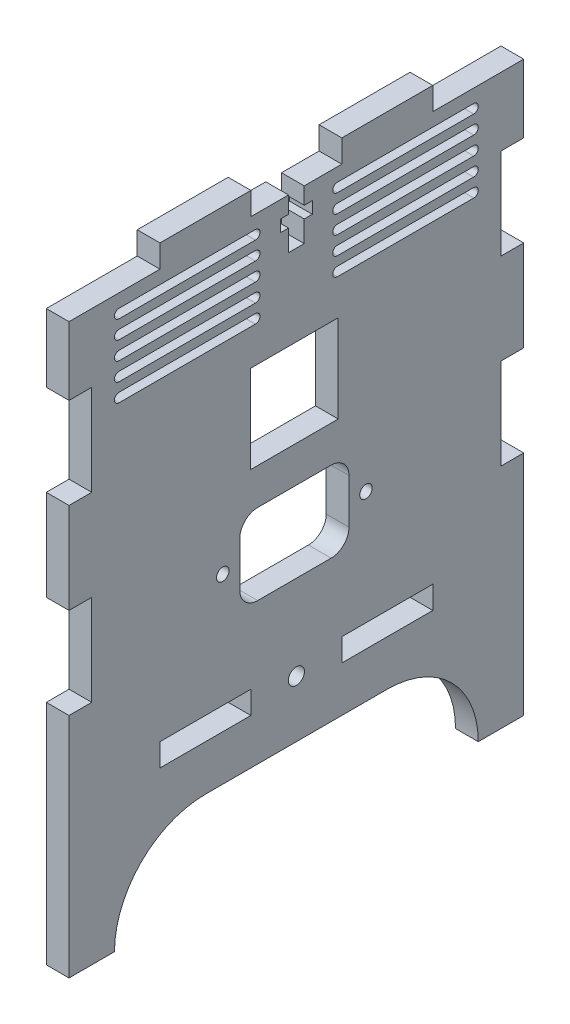
from build123d import *

# Parameters (mm, degrees)
SKETCH1_W                 = 127
SKETCH1_H                 = 165.1
BOSS_EXTRUDE1_DEPTH       = 6.35
SKETCH2_W                 = 25.4
SKETCH2_H                 = 6.35
CUT_EXTRUDE1_DEPTH        = 6.35
LPATTERN1_COUNT           = 3
LPATTERN1_PITCH           = 50.8
CUT_EXTRUDE4_DEPTH        = 6.35
SKETCH8_W                 = 6.35
SKETCH8_H                 = 25.4
CUT_EXTRUDE6_DEPTH        = 6.35
LPATTERN4_COUNT           = 2
LPATTERN4_PITCH           = 50.8
MIRROR1_COPY_1_SKETCH_W   = 6.35
MIRROR1_COPY_1_SKETCH_H   = 25.4
MIRROR1_COPY_1_DEPTH      = 6.35
MIRROR1_COPY_2_SKETCH_W   = 6.35
MIRROR1_COPY_2_SKETCH_H   = 25.4
MIRROR1_COPY_2_DEPTH      = 6.35
SKETCH9_W                 = 25.4
SKETCH9_H                 = 6.35
CUT_EXTRUDE7_DEPTH        = 6.35
LPATTERN6_COUNT           = 2
LPATTERN6_PITCH           = 50.8
SKETCH16_W                = 4.3942
SKETCH16_H                = 13.97
SKETCH16_W_2              = 8.89
SKETCH16_H_2              = 3.302
CUT_EXTRUDE14_DEPTH       = 6.35
F_8_CLEARANCE_HOLE1_D     = 4.4958
F_8_CLEARANCE_HOLE1_DEPTH = 10.16
F_8_CLEARANCE_HOLE1_TIP   = 1.350674586
CUT_EXTRUDE15_DEPTH       = 6.35
LPATTERN7_COPY_1_DEPTH    = 6.35
LPATTERN7_COPY_2_DEPTH    = 6.35
LPATTERN7_COPY_3_DEPTH    = 6.35
LPATTERN7_COPY_4_DEPTH    = 6.35
LPATTERN7_COPY_5_DEPTH    = 6.35
LPATTERN7_COPY_6_DEPTH    = 6.35
LPATTERN7_COPY_7_DEPTH    = 6.35
LPATTERN7_COPY_8_DEPTH    = 6.35
SKETCH20_R                = 1.75
CUT_EXTRUDE16_DEPTH       = 7.62
SKETCH22_W                = 24.5
SKETCH22_H                = 24.5
CUT_EXTRUDE17_DEPTH       = 6.35


with BuildPart() as part:
    # Sketch1 → Boss-Extrude1 (new body)
    with BuildSketch(Plane(origin=(0, 0, 0), x_dir=(0, 0, -1), z_dir=(1, 0, 0))):
        Rectangle(SKETCH1_W, SKETCH1_H)
    extrude(amount=BOSS_EXTRUDE1_DEPTH)

    # Sketch2 → Cut-Extrude1 (cut)
    with BuildSketch(Plane(origin=(6.35, 0, 0), x_dir=(0, 0, -1), z_dir=(1, 0, 0))):
        with Locations((-50.8, 79.375)):
            Rectangle(SKETCH2_W, SKETCH2_H)
    cut_extrude1 = extrude(amount=-CUT_EXTRUDE1_DEPTH, mode=Mode.SUBTRACT)

    # LPattern1: Cut-Extrude1 ×3
    with Locations(*[(0, 0, -i * LPATTERN1_PITCH) for i in range(1, LPATTERN1_COUNT)]):
        add(cut_extrude1, mode=Mode.SUBTRACT)

    # Sketch5 → Cut-Extrude4 (cut)
    with BuildSketch(Plane(origin=(6.35, 0, 0), x_dir=(0, 0, -1), z_dir=(1, 0, 0))):
        with BuildLine():
            Line((-25.4, -57.15), (25.4, -57.15))
            ThreePointArc((25.4, -57.15), (50.8, -82.55), (25.4, -107.95))
            Line((25.4, -107.95), (-25.4, -107.95))
            ThreePointArc((-25.4, -107.95), (-50.8, -82.55), (-25.4, -57.15))
        make_face()
    extrude(amount=-CUT_EXTRUDE4_DEPTH, mode=Mode.SUBTRACT)

    # Sketch8 → Cut-Extrude6 (cut)
    with BuildSketch(Plane(origin=(6.35, 0, 0), x_dir=(0, 0, -1), z_dir=(1, 0, 0))):
        with Locations((60.325, 44.45)):
            Rectangle(SKETCH8_W, SKETCH8_H)
    cut_extrude6 = extrude(amount=-CUT_EXTRUDE6_DEPTH, mode=Mode.SUBTRACT)

    # LPattern4: Cut-Extrude6 ×2
    with Locations(*[(0, -i * LPATTERN4_PITCH, 0) for i in range(1, LPATTERN4_COUNT)]):
        add(cut_extrude6, mode=Mode.SUBTRACT)

    # Mirror1 copy 1 sketch → Mirror1 copy 1 (cut)
    with BuildSketch(Plane(origin=(6.35, -50.8, 0), x_dir=(0, 0, 1), z_dir=(1, 0, 0))):
        with Locations((60.325, -44.45)):
            Rectangle(MIRROR1_COPY_1_SKETCH_W, MIRROR1_COPY_1_SKETCH_H)
    extrude(amount=-MIRROR1_COPY_1_DEPTH, mode=Mode.SUBTRACT)

    # Mirror1 copy 2 sketch → Mirror1 copy 2 (cut)
    with BuildSketch(Plane(origin=(6.35, 0, 0), x_dir=(0, 0, 1), z_dir=(1, 0, 0))):
        with Locations((60.325, -44.45)):
            Rectangle(MIRROR1_COPY_2_SKETCH_W, MIRROR1_COPY_2_SKETCH_H)
    extrude(amount=-MIRROR1_COPY_2_DEPTH, mode=Mode.SUBTRACT)

    # Sketch9 → Cut-Extrude7 (cut)
    with BuildSketch(Plane.ZY):
        with Locations((-25.4, -41.275)):
            Rectangle(SKETCH9_W, SKETCH9_H)
    cut_extrude7 = extrude(amount=-CUT_EXTRUDE7_DEPTH, mode=Mode.SUBTRACT)

    # LPattern6: Cut-Extrude7 ×2
    with Locations(*[(0, 0, i * LPATTERN6_PITCH) for i in range(1, LPATTERN6_COUNT)]):
        add(cut_extrude7, mode=Mode.SUBTRACT)

    # Sketch16 → Cut-Extrude14 (cut)
    with BuildSketch(Plane.ZY):
        with Locations((0, 69.215)):
            Rectangle(SKETCH16_W, SKETCH16_H)
        with Locations((0, 69.85)):
            Rectangle(SKETCH16_W_2, SKETCH16_H_2)
    extrude(amount=-CUT_EXTRUDE14_DEPTH, mode=Mode.SUBTRACT)

    # #8 Clearance Hole1
    with Locations(Plane.ZY):
        with Locations((0, -41.275)):
            Hole(F_8_CLEARANCE_HOLE1_D / 2, depth=F_8_CLEARANCE_HOLE1_DEPTH)
            with Locations((0, 0, -(F_8_CLEARANCE_HOLE1_DEPTH + F_8_CLEARANCE_HOLE1_TIP / 2))):  # 118° drill point
                Cone(0, F_8_CLEARANCE_HOLE1_D / 2, F_8_CLEARANCE_HOLE1_TIP, mode=Mode.SUBTRACT)

    # Sketch19 → Cut-Extrude15 (cut)
    with BuildSketch(Plane.ZY):
        with BuildLine():
            Line((-49.53, 72.448860523), (-11.43, 72.448860523))
            ThreePointArc((-11.43, 72.448860523), (-10.16, 71.178860523), (-11.43, 69.908860523))
            Line((-11.43, 69.908860523), (-49.53, 69.908860523))
            ThreePointArc((-49.53, 69.908860523), (-50.8, 71.178860523), (-49.53, 72.448860523))
        make_face()
    cut_extrude15 = extrude(amount=-CUT_EXTRUDE15_DEPTH, mode=Mode.SUBTRACT)

    # Mirror2: Cut-Extrude15 across plane
    add(cut_extrude15.mirror(Plane.XY), mode=Mode.SUBTRACT)

    # LPattern7 copy 1 sketch → LPattern7 copy 1 (cut)
    with BuildSketch(Plane(origin=(0, -5.08, 0), x_dir=(0, 0, -1), z_dir=(-1, 0, 0))):
        with BuildLine():
            Line((-49.53, -72.448860523), (-11.43, -72.448860523))
            ThreePointArc((-11.43, -72.448860523), (-10.16, -71.178860523), (-11.43, -69.908860523))
            Line((-11.43, -69.908860523), (-49.53, -69.908860523))
            ThreePointArc((-49.53, -69.908860523), (-50.8, -71.178860523), (-49.53, -72.448860523))
        make_face()
    extrude(amount=-LPATTERN7_COPY_1_DEPTH, mode=Mode.SUBTRACT)

    # LPattern7 copy 2 sketch → LPattern7 copy 2 (cut)
    with BuildSketch(Plane(origin=(0, -10.16, 0), x_dir=(0, 0, -1), z_dir=(-1, 0, 0))):
        with BuildLine():
            Line((-49.53, -72.448860523), (-11.43, -72.448860523))
            ThreePointArc((-11.43, -72.448860523), (-10.16, -71.178860523), (-11.43, -69.908860523))
            Line((-11.43, -69.908860523), (-49.53, -69.908860523))
            ThreePointArc((-49.53, -69.908860523), (-50.8, -71.178860523), (-49.53, -72.448860523))
        make_face()
    extrude(amount=-LPATTERN7_COPY_2_DEPTH, mode=Mode.SUBTRACT)

    # LPattern7 copy 3 sketch → LPattern7 copy 3 (cut)
    with BuildSketch(Plane(origin=(0, -15.24, 0), x_dir=(0, 0, -1), z_dir=(-1, 0, 0))):
        with BuildLine():
            Line((-49.53, -72.448860523), (-11.43, -72.448860523))
            ThreePointArc((-11.43, -72.448860523), (-10.16, -71.178860523), (-11.43, -69.908860523))
            Line((-11.43, -69.908860523), (-49.53, -69.908860523))
            ThreePointArc((-49.53, -69.908860523), (-50.8, -71.178860523), (-49.53, -72.448860523))
        make_face()
    extrude(amount=-LPATTERN7_COPY_3_DEPTH, mode=Mode.SUBTRACT)

    # LPattern7 copy 4 sketch → LPattern7 copy 4 (cut)
    with BuildSketch(Plane(origin=(0, -20.32, 0), x_dir=(0, 0, -1), z_dir=(-1, 0, 0))):
        with BuildLine():
            Line((-49.53, -72.448860523), (-11.43, -72.448860523))
            ThreePointArc((-11.43, -72.448860523), (-10.16, -71.178860523), (-11.43, -69.908860523))
            Line((-11.43, -69.908860523), (-49.53, -69.908860523))
            ThreePointArc((-49.53, -69.908860523), (-50.8, -71.178860523), (-49.53, -72.448860523))
        make_face()
    extrude(amount=-LPATTERN7_COPY_4_DEPTH, mode=Mode.SUBTRACT)

    # LPattern7 copy 5 sketch → LPattern7 copy 5 (cut)
    with BuildSketch(Plane(origin=(0, -5.08, 0), x_dir=(0, 0, 1), z_dir=(-1, 0, 0))):
        with BuildLine():
            Line((-49.53, 72.448860523), (-11.43, 72.448860523))
            ThreePointArc((-11.43, 72.448860523), (-10.16, 71.178860523), (-11.43, 69.908860523))
            Line((-11.43, 69.908860523), (-49.53, 69.908860523))
            ThreePointArc((-49.53, 69.908860523), (-50.8, 71.178860523), (-49.53, 72.448860523))
        make_face()
    extrude(amount=-LPATTERN7_COPY_5_DEPTH, mode=Mode.SUBTRACT)

    # LPattern7 copy 6 sketch → LPattern7 copy 6 (cut)
    with BuildSketch(Plane(origin=(0, -10.16, 0), x_dir=(0, 0, 1), z_dir=(-1, 0, 0))):
        with BuildLine():
            Line((-49.53, 72.448860523), (-11.43, 72.448860523))
            ThreePointArc((-11.43, 72.448860523), (-10.16, 71.178860523), (-11.43, 69.908860523))
            Line((-11.43, 69.908860523), (-49.53, 69.908860523))
            ThreePointArc((-49.53, 69.908860523), (-50.8, 71.178860523), (-49.53, 72.448860523))
        make_face()
    extrude(amount=-LPATTERN7_COPY_6_DEPTH, mode=Mode.SUBTRACT)

    # LPattern7 copy 7 sketch → LPattern7 copy 7 (cut)
    with BuildSketch(Plane(origin=(0, -15.24, 0), x_dir=(0, 0, 1), z_dir=(-1, 0, 0))):
        with BuildLine():
            Line((-49.53, 72.448860523), (-11.43, 72.448860523))
            ThreePointArc((-11.43, 72.448860523), (-10.16, 71.178860523), (-11.43, 69.908860523))
            Line((-11.43, 69.908860523), (-49.53, 69.908860523))
            ThreePointArc((-49.53, 69.908860523), (-50.8, 71.178860523), (-49.53, 72.448860523))
        make_face()
    extrude(amount=-LPATTERN7_COPY_7_DEPTH, mode=Mode.SUBTRACT)

    # LPattern7 copy 8 sketch → LPattern7 copy 8 (cut)
    with BuildSketch(Plane(origin=(0, -20.32, 0), x_dir=(0, 0, 1), z_dir=(-1, 0, 0))):
        with BuildLine():
            Line((-49.53, 72.448860523), (-11.43, 72.448860523))
            ThreePointArc((-11.43, 72.448860523), (-10.16, 71.178860523), (-11.43, 69.908860523))
            Line((-11.43, 69.908860523), (-49.53, 69.908860523))
            ThreePointArc((-49.53, 69.908860523), (-50.8, 71.178860523), (-49.53, 72.448860523))
        make_face()
    extrude(amount=-LPATTERN7_COPY_8_DEPTH, mode=Mode.SUBTRACT)

    # Sketch20 → Cut-Extrude16 (cut)
    with BuildSketch(Plane.ZY):
        with Locations((-19.442525155, -6.35)):
            Circle(SKETCH20_R)
        with Locations((20.557474845, -6.35)):
            Circle(SKETCH20_R)
        with BuildLine():
            Line((-9.692525155, 4.9), (10.807474845, 4.9))
            ThreePointArc((10.807474845, 4.9), (14.343008751, 3.435533906), (15.807474845, -0.1))
            Line((15.807474845, -0.1), (15.807474845, -12.6))
            ThreePointArc((15.807474845, -12.6), (14.343008751, -16.135533906), (10.807474845, -17.6))
            Line((10.807474845, -17.6), (-9.692525155, -17.6))
            ThreePointArc((-9.692525155, -17.6), (-13.228059061, -16.135533906), (-14.692525155, -12.6))
            Line((-14.692525155, -12.6), (-14.692525155, -0.1))
            ThreePointArc((-14.692525155, -0.1), (-13.228059061, 3.435533906), (-9.692525155, 4.9))
        make_face()
    extrude(amount=-CUT_EXTRUDE16_DEPTH, mode=Mode.SUBTRACT)

    # Sketch22 → Cut-Extrude17 (cut)
    with BuildSketch(Plane.ZY):
        with Locations((0.557474845, 27.31)):
            Rectangle(SKETCH22_W, SKETCH22_H)
    extrude(amount=-CUT_EXTRUDE17_DEPTH, mode=Mode.SUBTRACT)


solid = part.part
